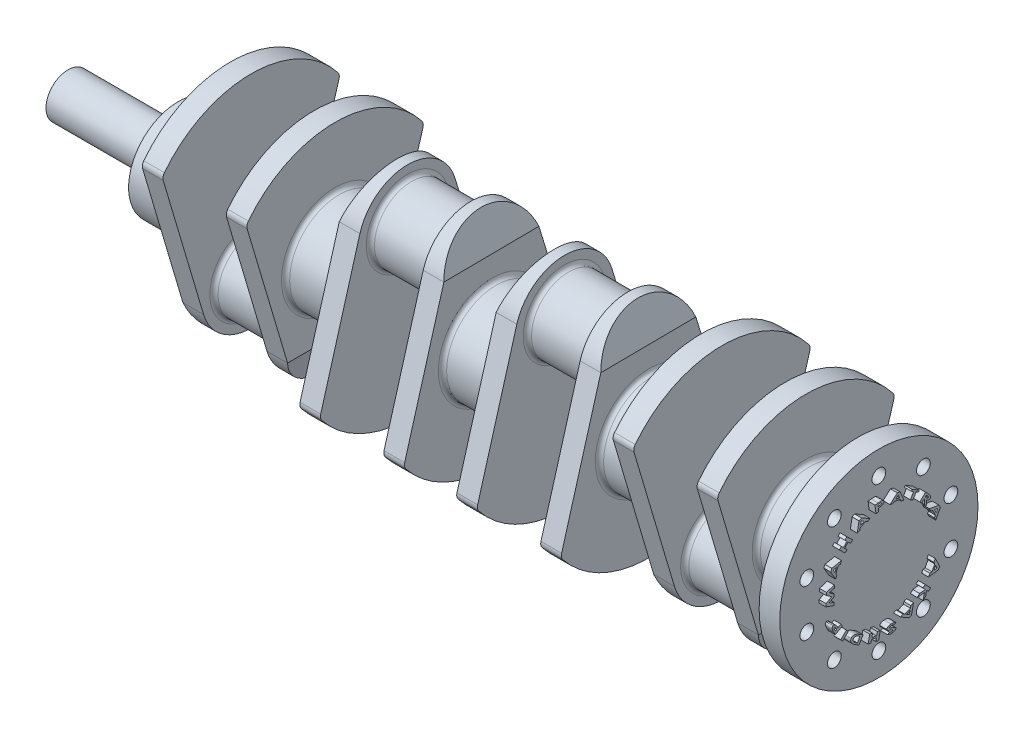
from build123d import *

# Parameters (mm, degrees)
SKETCH1_R               = 36
BOSS_EXTRUDE1_DEPTH     = 38
SKETCH3_R               = 27
BOSS_EXTRUDE2_DEPTH     = 15
SKETCH3_2_R             = 27
BOSS_EXTRUDE3_DEPTH     = 61
CUT_EXTRUDE1_DEPTH      = 143.724458813
CUT_EXTRUDE1_DEPTH_BACK = 143.724458813
BODY_MOVE_COPY1_ANGLE   = 179.5
BOSS_EXTRUDE4_START     = 15
SKETCH5_R               = 72
SKETCH5_R_2             = 5
SKETCH5_R_3             = 36
BOSS_EXTRUDE4_DEPTH     = 15
SKETCH6_R               = 16
BOSS_EXTRUDE5_DEPTH     = 80
FILLET1_R               = 3
FILLET2_R               = 5
WRAP1_DEPTH             = 5


# Read off the part's stored shape, not the designer's step: Wrap1
with BuildPart() as part:
    # Sketch1 → Boss-Extrude1 (new body)
    with BuildSketch(Plane(origin=(0, 0, 0), x_dir=(0, 0, -1), z_dir=(1, 0, 0))):
        Circle(SKETCH1_R)
    extrude(amount=BOSS_EXTRUDE1_DEPTH)

    # Sketch3 → Boss-Extrude2 (add)
    with BuildSketch(Plane(origin=(38, 0, 0), x_dir=(0, 0, -1), z_dir=(1, 0, 0))):
        with BuildLine():
            Line((-34.517510455, -54.224552409), (-64.569893475, 47.23059238))
            ThreePointArc((-64.569893475, 47.23059238), (0, 80), (64.569893475, 47.23059238))
            Line((64.569893475, 47.23059238), (34.517510455, -54.224552409))
            ThreePointArc((34.517510455, -54.224552409), (0, -80), (-34.517510455, -54.224552409))
        make_face()
        with Locations(Location((0, -44, 0), (0, 0, 144.817798311))):
            Circle(SKETCH3_R, mode=Mode.SUBTRACT)
    extrude(amount=BOSS_EXTRUDE2_DEPTH)

    # Sketch3<2> → Boss-Extrude3 (add)
    with BuildSketch(Plane(origin=(38, 0, 0), x_dir=(0, 0, -1), z_dir=(1, 0, 0))):
        with Locations(Location((0, -44, 0), (0, 0, 180))):
            Circle(SKETCH3_2_R)
    extrude(amount=BOSS_EXTRUDE3_DEPTH)

    # Sketch4 → Cut-Extrude1 (cut, two sides: drawn at the far end of the back side and taken through both)
    with BuildSketch(Plane.XY.offset(-CUT_EXTRUDE1_DEPTH_BACK)):
        Polygon((38, -54.224552409), (45.5, -80), (38, -80), align=None)
    extrude(amount=CUT_EXTRUDE1_DEPTH + CUT_EXTRUDE1_DEPTH_BACK, mode=Mode.SUBTRACT)

    # Mirror3: part across plane


with BuildPart() as part_1:
    add(part.part)
    add(part.part.mirror(Plane(origin=(76, 0, 0), x_dir=(0, 0, 1), z_dir=(1, 0, 0))))


with BuildPart() as body_2:
    # Mirror4: mirrored copy
    add(part_1.part.mirror(Plane(origin=(133, 0, 0), x_dir=(0, 0, 1), z_dir=(1, 0, 0))))


with BuildPart() as body_2_1:
    # Body-Move/Copy1: moved
    add(body_2.part.rotate(Axis((0, 0, 0), (-1, 0, 0)), BODY_MOVE_COPY1_ANGLE))


with BuildPart() as part_2:
    add(part_1.part)

    # Combine1: union body 2
    add(body_2_1.part)

    # Mirror5: part across plane


with BuildPart() as part_3:
    add(part_2.part)
    add(part_2.part.mirror(Plane(origin=(247, 0, 0), x_dir=(0, 0, 1), z_dir=(1, 0, 0))))

    # Sketch5 → Boss-Extrude4 (add)
    # profile 1 of 2: a face of its own
    with BuildSketch(Plane(origin=(494, 0, 0), x_dir=(0, 0, -1), z_dir=(1, 0, 0)).offset(BOSS_EXTRUDE4_START)):
        Circle(SKETCH5_R)
        with Locations((-32.328188876, 44.495934691)):
            Circle(SKETCH5_R_2, mode=Mode.SUBTRACT)
        with Locations((-52.308108396, 16.995934691)):
            Circle(SKETCH5_R_2, mode=Mode.SUBTRACT)
        with Locations((-52.308108396, -16.995934691)):
            Circle(SKETCH5_R_2, mode=Mode.SUBTRACT)
        with Locations((-32.328188876, -44.495934691)):
            Circle(SKETCH5_R_2, mode=Mode.SUBTRACT)
        with Locations((0, -55)):
            Circle(SKETCH5_R_2, mode=Mode.SUBTRACT)
        with Locations((32.328188876, -44.495934691)):
            Circle(SKETCH5_R_2, mode=Mode.SUBTRACT)
        with Locations((52.308108396, -16.995934691)):
            Circle(SKETCH5_R_2, mode=Mode.SUBTRACT)
        with Locations((52.308108396, 16.995934691)):
            Circle(SKETCH5_R_2, mode=Mode.SUBTRACT)
        with Locations((32.328188876, 44.495934691)):
            Circle(SKETCH5_R_2, mode=Mode.SUBTRACT)
        with Locations((0, 55)):
            Circle(SKETCH5_R_2, mode=Mode.SUBTRACT)
        Circle(SKETCH5_R_3, mode=Mode.SUBTRACT)
    # profile 2 of 2: a face of its own
    with BuildSketch(Plane(origin=(494, 0, 0), x_dir=(0, 0, -1), z_dir=(1, 0, 0)).offset(BOSS_EXTRUDE4_START)):
        Circle(SKETCH5_R_3)
    extrude(amount=-BOSS_EXTRUDE4_DEPTH)

    # Sketch6 → Boss-Extrude5 (add)
    with BuildSketch(Plane.ZY):
        Circle(SKETCH6_R)
    extrude(amount=BOSS_EXTRUDE5_DEPTH)

    # Fillet1
    fillet1_edges = [part_3.edges().sort_by_distance(p)[0] for p in [
        (53, -44, -27),
        (456, 0, 36),
        (494, 0, 36),
        (441, -44, -27),
        (395, -44, -27),
        (342, 0, 36),
        (380, 0, 36),
        (281, 43.762708156, 27.382939485),
        (327, 43.762708156, 27.382939485),
        (0, 0, -16),
        (99, -44, -27),
        (38, 0, 36),
        (114, 0, 36),
        (152, 0, 36),
        (228, 0.314155278, -35.99862923),
        (266, 0.314155278, -35.99862923),
        (213, 43.762708156, 27.382939485),
        (167, 43.762708156, 27.382939485),
    ]]
    fillet(fillet1_edges, radius=FILLET1_R)

    # Fillet2
    fillet2_edges = [part_3.edges().sort_by_distance(p)[0] for p in [
        (45.5, 47.23059238, 64.569893475),
        (448.5, 47.23059238, -64.569893475),
        (448.5, 47.23059238, 64.569893475),
        (387.5, 47.23059238, -64.569893475),
        (387.5, 47.23059238, 64.569893475),
        (273.5, -47.792265452, 64.155275411),
        (273.5, -46.665322516, -64.979594293),
        (334.5, -47.792265452, 64.155275411),
        (334.5, -46.665322516, -64.979594293),
        (106.5, 47.23059238, -64.569893475),
        (106.5, 47.23059238, 64.569893475),
        (220.5, -47.792265452, 64.155275411),
        (220.5, -46.665322516, -64.979594293),
        (159.5, -47.792265452, 64.155275411),
        (159.5, -46.665322516, -64.979594293),
        (45.5, 47.23059238, -64.569893475),
    ]]
    fillet(fillet2_edges, radius=FILLET2_R)

    # Wrap1 outline → Wrap1 (add)
    # profile 1 of 17: a face of its own
    with BuildSketch(Plane(origin=(509, 0, 0), x_dir=(0, 0, -1), z_dir=(1, 0, 0))):
        with BuildLine():
            add(Edge.make_bspline(
                [(30.429145669, 31.278633196), (30.529714484, 31.175524895), (30.723586774, 30.97675709), (30.998471286, 30.685651702), (31.247338782, 30.41362089), (31.470231429, 30.161696818), (31.665061076, 29.927807723), (31.835209086, 29.715007837), (31.977848594, 29.52002756), (32.09739194, 29.341520557), (32.195364999, 29.171832525), (32.282688438, 29.009274234), (32.355863107, 28.847193799), (32.419966671, 28.687840548), (32.469403122, 28.528430808), (32.510142867, 28.371486623), (32.536172291, 28.215731032), (32.553469658, 28.063541172), (32.55684607, 27.91529612), (32.548408891, 27.773035329), (32.524589617, 27.637930635), (32.488880662, 27.509728828), (32.438023848, 27.389132553), (32.37520509, 27.275109299), (32.297221124, 27.16917764), (32.236800833, 27.105186363), (32.206178923, 27.072754623)],
                knots=[0, 0, 0, 0, 0.086183646, 0.166141174, 0.239561119, 0.306794224, 0.367392138, 0.421693658, 0.469793409, 0.511914684, 0.5501677, 0.58699646, 0.622277761, 0.656525956, 0.689699113, 0.722076818, 0.753468047, 0.784108508, 0.813653429, 0.842088185, 0.869235459, 0.895591144, 0.921549795, 0.947369509, 0.973326077, 1, 1, 1, 1], degree=3))
            Line((30.429145669, 31.278633196), (28.898145235, 32.836452373))
            Line((28.898145235, 32.836452373), (24.770390828, 28.78099197))
            Line((24.770390828, 28.78099197), (26.213938839, 27.311791248))
            Line((26.213938839, 27.311791248), (27.961821284, 29.029356853))
            Line((27.961821284, 29.029356853), (28.095915, 28.892931072))
            Line((28.095915, 28.892931072), (28.055103869, 25.439143345))
            Line((28.055103869, 25.439143345), (29.632745596, 23.833516843))
            Line((29.632745596, 23.833516843), (29.673556727, 27.46337545))
            add(Edge.make_bspline(
                [(32.206178923, 27.072754623), (32.171961657, 27.041121702), (32.104221329, 26.97849763), (31.990451903, 26.901801135), (31.869962485, 26.840696535), (31.743165908, 26.79307029), (31.608554693, 26.763003301), (31.466866723, 26.749837996), (31.318767717, 26.749263935), (31.163509451, 26.766904468), (31.001494792, 26.798121919), (30.832517724, 26.847024585), (30.656742721, 26.911613183), (30.473476864, 26.991243783), (30.283170427, 27.086515942), (30.08501184, 27.195703857), (29.880398297, 27.322481134), (29.743945745, 27.415428548), (29.673556727, 27.46337545)],
                knots=[0, 0, 0, 0, 0.050124638, 0.099232343, 0.14715377, 0.195359514, 0.244709218, 0.295187372, 0.348344958, 0.403905245, 0.463173033, 0.525841674, 0.593106823, 0.664720363, 0.740905851, 0.822215008, 0.908289653, 1, 1, 1, 1], degree=3))
        make_face()
        with BuildLine():
            add(Edge.make_bspline(
                [(29.182657121, 29.319698901), (29.238412559, 29.263513059), (29.345092754, 29.156009347), (29.501859082, 29.004855542), (29.648088289, 28.870671225), (29.785249965, 28.754042322), (29.910196652, 28.651940565), (30.026020716, 28.567823102), (30.130415707, 28.499153161), (30.226555787, 28.447933205), (30.315355525, 28.410286306), (30.399698109, 28.387035496), (30.479615524, 28.374216182), (30.555620577, 28.3756137), (30.628043002, 28.388044977), (30.696050095, 28.414438721), (30.760670545, 28.451843357), (30.797433269, 28.485984366), (30.816268399, 28.503476278)],
                knots=[0, 0, 0, 0, 0.11871841, 0.227150992, 0.326598645, 0.416323744, 0.497170778, 0.568533097, 0.630950928, 0.684412112, 0.731721949, 0.775284498, 0.8153523, 0.852666451, 0.888800719, 0.924963191, 0.961555406, 1, 1, 1, 1], degree=3))
            Line((29.182657121, 29.319698901), (28.727904517, 29.781447699))
            Line((28.727904517, 29.781447699), (29.572111915, 30.611662709))
            Line((29.572111915, 30.611662709), (29.968562904, 30.208215527))
            add(Edge.make_bspline(
                [(30.816268399, 28.503476278), (30.836700296, 28.526640455), (30.877740004, 28.573168249), (30.914707454, 28.661305922), (30.931124018, 28.760164094), (30.924532334, 28.868789509), (30.901054465, 28.985355536), (30.857967242, 29.10678091), (30.797799835, 29.232625813), (30.731975951, 29.339354876), (30.6684681, 29.433178212), (30.604002347, 29.512772859), (30.530345492, 29.60522887), (30.442411303, 29.706354153), (30.341799628, 29.817241255), (30.228557933, 29.938032555), (30.103829801, 30.070585617), (30.014996402, 30.16097087), (29.968562904, 30.208215527)],
                knots=[0, 0, 0, 0, 0.044650945, 0.089686329, 0.136688453, 0.189283969, 0.246905011, 0.30908811, 0.376061549, 0.449318408, 0.491164293, 0.540670563, 0.598116814, 0.663018007, 0.735422287, 0.815776509, 0.9037058, 1, 1, 1, 1], degree=3))
        make_face(mode=Mode.SUBTRACT)
    # profile 2 of 17: a face of its own
    with BuildSketch(Plane(origin=(509, 0, 0), x_dir=(0, 0, -1), z_dir=(1, 0, 0))):
        with BuildLine():
            add(Edge.make_bspline(
                [(-5.622220222, 43.296977633), (-5.480400337, 43.312592244), (-5.206677104, 43.342729638), (-4.810936692, 43.378860622), (-4.445112894, 43.405660973), (-4.109669055, 43.425115991), (-3.8040552, 43.434317908), (-3.528746531, 43.436338864), (-3.283637265, 43.42882642), (-3.065315646, 43.411467215), (-2.86672486, 43.384619422), (-2.680272938, 43.353393101), (-2.503944058, 43.310402051), (-2.336845204, 43.262493672), (-2.180042362, 43.204261582), (-2.031355707, 43.141492745), (-1.893810958, 43.066987109), (-1.765300678, 42.987381996), (-1.648744829, 42.899865775), (-1.543982804, 42.806742157), (-1.453404254, 42.705962781), (-1.377516566, 42.597896413), (-1.31382102, 42.484484312), (-1.264464273, 42.364337649), (-1.229021656, 42.237438112), (-1.216374339, 42.149788123), (-1.209953929, 42.105292603)],
                knots=[0, 0, 0, 0, 0.085263731, 0.164565526, 0.237464279, 0.304463238, 0.3653482, 0.420166087, 0.468971369, 0.511852137, 0.550977558, 0.588706681, 0.624763539, 0.659382178, 0.692523, 0.724669681, 0.755740161, 0.785901322, 0.814935959, 0.842732648, 0.869545314, 0.895710275, 0.921497217, 0.947119392, 0.973155158, 1, 1, 1, 1], degree=3))
            Line((-5.622220222, 43.296977633), (-7.798036528, 43.053276878))
            Line((-7.798036528, 43.053276878), (-7.15555272, 37.317563904))
            Line((-7.15555272, 37.317563904), (-5.104501872, 37.547272271))
            Line((-5.104501872, 37.547272271), (-5.377353435, 39.97611759))
            add(Edge.make_bspline(
                [(-3.226023807, 40.308436801), (-3.279558015, 40.294771483), (-3.396547762, 40.264908294), (-3.589083268, 40.226859362), (-3.812043643, 40.185482526), (-4.066113743, 40.145593177), (-4.350636096, 40.103624517), (-4.665426864, 40.060431791), (-5.010985976, 40.017293707), (-5.251779336, 39.99023089), (-5.377353435, 39.97611759)],
                knots=[0, 0, 0, 0, 0.076079011, 0.166257513, 0.270200311, 0.388387942, 0.52041265, 0.666291712, 0.825970627, 1, 1, 1, 1], degree=3))
            add(Edge.make_bspline(
                [(-1.209953929, 42.105292603), (-1.206300346, 42.055950966), (-1.199100534, 41.958717503), (-1.211319953, 41.813395423), (-1.243098574, 41.672682688), (-1.293800521, 41.536279302), (-1.363582145, 41.404227975), (-1.453054451, 41.277102347), (-1.561157055, 41.153776013), (-1.689059968, 41.037062105), (-1.831919809, 40.924172382), (-1.990114637, 40.818613509), (-2.161106307, 40.717592016), (-2.346791019, 40.62369052), (-2.546479501, 40.535068163), (-2.760248551, 40.452649595), (-2.987566383, 40.375079451), (-3.145333203, 40.330987727), (-3.226023807, 40.308436801)],
                knots=[0, 0, 0, 0, 0.050511539, 0.099538891, 0.148405011, 0.197554546, 0.247846877, 0.300638037, 0.356100292, 0.415136975, 0.477370203, 0.542050923, 0.609369429, 0.680262357, 0.754605722, 0.832589137, 0.914376903, 1, 1, 1, 1], degree=3))
        make_face()
        with BuildLine():
            add(Edge.make_bspline(
                [(-4.844476665, 41.114165133), (-4.783069442, 41.12157563), (-4.66489817, 41.135836297), (-4.494823779, 41.15594357), (-4.339818351, 41.178434731), (-4.199463228, 41.200445255), (-4.073900252, 41.222559957), (-3.962813041, 41.243927313), (-3.86745717, 41.267786799), (-3.761296366, 41.295986876), (-3.64692827, 41.338154972), (-3.524266088, 41.394408491), (-3.419145516, 41.460199428), (-3.331369841, 41.532975402), (-3.261755654, 41.612447999), (-3.214928194, 41.698737246), (-3.191178295, 41.790778376), (-3.193412214, 41.852540334), (-3.194540935, 41.883746463)],
                knots=[0, 0, 0, 0, 0.093628204, 0.180176914, 0.259221216, 0.330702091, 0.395219142, 0.452218799, 0.501877336, 0.543984089, 0.618427735, 0.686066927, 0.747932726, 0.805560497, 0.858144179, 0.906838381, 0.952928734, 1, 1, 1, 1], degree=3))
            Line((-4.844476665, 41.114165133), (-5.496288731, 41.040705097))
            Line((-5.496288731, 41.040705097), (-5.628050383, 42.213733609))
            Line((-5.628050383, 42.213733609), (-5.049698353, 42.279031419))
            add(Edge.make_bspline(
                [(-3.733247866, 42.312846356), (-3.766610864, 42.318419365), (-3.839219596, 42.330548046), (-3.958188721, 42.338214739), (-4.09505456, 42.343248753), (-4.250263839, 42.341493053), (-4.424056137, 42.334295124), (-4.616496058, 42.321250782), (-4.827133079, 42.302308516), (-4.973536872, 42.286996804), (-5.049698353, 42.279031419)],
                knots=[0, 0, 0, 0, 0.076795943, 0.167132944, 0.270497902, 0.38793295, 0.519598425, 0.665607792, 0.826044084, 1, 1, 1, 1], degree=3))
            add(Edge.make_bspline(
                [(-3.194540935, 41.883746463), (-3.198826595, 41.910485214), (-3.207286662, 41.963268594), (-3.240068496, 42.036635573), (-3.286717412, 42.102102904), (-3.347645678, 42.160183568), (-3.423673513, 42.210270246), (-3.513971504, 42.253100692), (-3.618685583, 42.287853279), (-3.693807703, 42.304242032), (-3.733247866, 42.312846356)],
                knots=[0, 0, 0, 0, 0.10925285, 0.215669566, 0.321771664, 0.433068059, 0.554402804, 0.688837443, 0.836635309, 1, 1, 1, 1], degree=3))
        make_face(mode=Mode.SUBTRACT)
    # profile 3 of 17: a face of its own
    with BuildSketch(Plane(origin=(509, 0, 0), x_dir=(0, 0, -1), z_dir=(1, 0, 0))):
        with BuildLine():
            add(Edge.make_bspline(
                [(-37.6596163, -22.112060764), (-37.729142009, -21.987483758), (-37.863159205, -21.747350127), (-38.051321694, -21.3973175), (-38.218808858, -21.071333799), (-38.367938928, -20.770146189), (-38.49606757, -20.492854973), (-38.605553252, -20.240256195), (-38.692923128, -20.011193031), (-38.764028601, -19.804272258), (-38.817000007, -19.611197005), (-38.85944948, -19.427704374), (-38.889915143, -19.249354534), (-38.909793846, -19.0769213), (-38.919815247, -18.90987164), (-38.917129491, -18.748592087), (-38.90500097, -18.592985072), (-38.880141999, -18.443764972), (-38.846122014, -18.301789681), (-38.799589048, -18.169117543), (-38.740258062, -18.046988849), (-38.672351789, -17.933622358), (-38.59176824, -17.830938675), (-38.500522371, -17.738295281), (-38.397231175, -17.656099002), (-38.321668982, -17.61000657), (-38.28344359, -17.586689336)],
                knots=[0, 0, 0, 0, 0.085281514, 0.164387959, 0.237543378, 0.304357025, 0.365275386, 0.420129158, 0.468888674, 0.511797458, 0.550862296, 0.588513439, 0.624342608, 0.658955573, 0.692232668, 0.724299458, 0.755306674, 0.785444252, 0.814634604, 0.842485815, 0.869297104, 0.89567604, 0.921331871, 0.947126202, 0.97325221, 1, 1, 1, 1], degree=3))
            Line((-37.6596163, -22.112060764), (-36.586866567, -24.01619154))
            Line((-36.586866567, -24.01619154), (-31.548440919, -21.176902844))
            Line((-31.548440919, -21.176902844), (-32.560556971, -19.381213074))
            Line((-32.560556971, -19.381213074), (-34.694396114, -20.583392394))
            add(Edge.make_bspline(
                [(-35.839439851, -18.736397202), (-35.806096198, -18.780483845), (-35.733334243, -18.876688975), (-35.622156202, -19.038254999), (-35.497747142, -19.226785002), (-35.360672871, -19.44356896), (-35.212614477, -19.689192572), (-35.050245972, -19.96227076), (-34.875271666, -20.262866532), (-34.756330253, -20.473640174), (-34.694396114, -20.583392394)],
                knots=[0, 0, 0, 0, 0.076248107, 0.166387334, 0.270489101, 0.387859604, 0.520188358, 0.666126712, 0.826148401, 1, 1, 1, 1], degree=3))
            add(Edge.make_bspline(
                [(-38.28344359, -17.586689336), (-38.239279681, -17.564079795), (-38.152059664, -17.519427848), (-38.013228165, -17.47452152), (-37.871535937, -17.446646318), (-37.725836973, -17.439931377), (-37.576707549, -17.453586496), (-37.424298836, -17.485015423), (-37.269310157, -17.537973935), (-37.111275988, -17.607774369), (-36.952034961, -17.695846275), (-36.792081689, -17.798860909), (-36.631737008, -17.916938784), (-36.472852017, -18.051757577), (-36.312041614, -18.19952693), (-36.154620686, -18.365371791), (-35.993489804, -18.54292301), (-35.891596991, -18.670892082), (-35.839439851, -18.736397202)],
                knots=[0, 0, 0, 0, 0.050632458, 0.09999486, 0.148525686, 0.197835325, 0.248467783, 0.301204873, 0.356470488, 0.415512229, 0.477548236, 0.54222254, 0.60982719, 0.680872694, 0.75507247, 0.832882904, 0.914455694, 1, 1, 1, 1], degree=3))
        make_face()
        with BuildLine():
            add(Edge.make_bspline(
                [(-35.950212921, -20.540249199), (-35.980772721, -20.4861404), (-36.039262614, -20.38257893), (-36.125791522, -20.234762413), (-36.207908649, -20.101437836), (-36.281312061, -19.979676571), (-36.351683206, -19.873626931), (-36.415971942, -19.781197832), (-36.47375888, -19.701854257), (-36.542207768, -19.616078555), (-36.625930831, -19.527514708), (-36.725416408, -19.436015575), (-36.82773037, -19.365612006), (-36.928814375, -19.313041247), (-37.02876529, -19.281944383), (-37.125695483, -19.271040862), (-37.219728843, -19.284797691), (-37.275739848, -19.311687617), (-37.303976443, -19.325243523)],
                knots=[0, 0, 0, 0, 0.094145789, 0.18019022, 0.25946636, 0.331373404, 0.395557877, 0.45224046, 0.501941496, 0.544244423, 0.618401923, 0.686375025, 0.748606577, 0.80601552, 0.858356821, 0.906285607, 0.952756154, 1, 1, 1, 1], degree=3))
            Line((-35.950212921, -20.540249199), (-35.629554033, -21.110439002))
            Line((-35.629554033, -21.110439002), (-36.660326603, -21.691123097))
            Line((-36.660326603, -21.691123097), (-36.944838489, -21.185065071))
            add(Edge.make_bspline(
                [(-37.489375581, -19.98754988), (-37.481709477, -20.020336808), (-37.464999894, -20.091801521), (-37.426337088, -20.204790645), (-37.376060916, -20.332562743), (-37.313884848, -20.474755365), (-37.240049736, -20.632052951), (-37.152437079, -20.803441095), (-37.053430089, -20.990097393), (-36.982001205, -21.118342337), (-36.944838489, -21.185065071)],
                knots=[0, 0, 0, 0, 0.076522088, 0.166792964, 0.271172315, 0.388728042, 0.519589831, 0.666225044, 0.826344985, 1, 1, 1, 1], degree=3))
            add(Edge.make_bspline(
                [(-37.303976443, -19.325243523), (-37.326941597, -19.339390127), (-37.372254576, -19.367303058), (-37.425834394, -19.426688848), (-37.46960177, -19.494321271), (-37.497710037, -19.573825258), (-37.515609257, -19.662906253), (-37.519327544, -19.76226064), (-37.510582485, -19.872019951), (-37.496705038, -19.947620827), (-37.489375581, -19.98754988)],
                knots=[0, 0, 0, 0, 0.108860319, 0.214794341, 0.321056187, 0.433773539, 0.554329405, 0.68845439, 0.835455331, 1, 1, 1, 1], degree=3))
        make_face(mode=Mode.SUBTRACT)
    # profile 4 of 17: a face of its own
    with BuildSketch(Plane(origin=(509, 0, 0), x_dir=(0, 0, -1), z_dir=(1, 0, 0))):
        with BuildLine():
            add(Edge.make_bspline(
                [(-21.561806926, -37.865119371), (-21.64431798, -37.813990965), (-21.806295318, -37.713620861), (-22.043533488, -37.562414882), (-22.272021808, -37.415396561), (-22.489458779, -37.268323213), (-22.700398417, -37.128735099), (-22.899184734, -36.987554836), (-23.090400895, -36.852181365), (-23.271615083, -36.718420197), (-23.444120558, -36.588705679), (-23.6060531, -36.460082544), (-23.758906928, -36.334950424), (-23.903782283, -36.214499387), (-24.038101314, -36.095259351), (-24.162594345, -35.978288561), (-24.279353505, -35.866067769), (-24.420191376, -35.720185143), (-24.582286171, -35.537945469), (-24.759729084, -35.31401759), (-24.919760636, -35.086033128), (-25.063789909, -34.855205853), (-25.189978882, -34.620355409), (-25.299242743, -34.381797211), (-25.389692476, -34.138722046), (-25.464985574, -33.894253275), (-25.5187656, -33.650242248), (-25.550182599, -33.410253443), (-25.555508477, -33.176246405), (-25.539924592, -32.947984148), (-25.499313491, -32.725605378), (-25.432169603, -32.509876706), (-25.346333131, -32.298212847), (-25.26911768, -32.165881417), (-25.230144599, -32.099089557)],
                knots=[0, 0, 0, 0, 0.038475521, 0.075531242, 0.111512892, 0.146166871, 0.179581902, 0.211766711, 0.242804186, 0.272447562, 0.301042266, 0.328351756, 0.354411043, 0.379344812, 0.403027242, 0.425590776, 0.447054505, 0.467211112, 0.505952528, 0.543680493, 0.580396447, 0.616308104, 0.651462248, 0.68600337, 0.72022797, 0.754198136, 0.787318856, 0.819155159, 0.849977758, 0.879944067, 0.909708904, 0.939340667, 0.969383315, 1, 1, 1, 1], degree=3))
            Line((-21.561806926, -37.865119371), (-19.480439237, -39.150086986))
            Line((-19.480439237, -39.150086986), (-16.434762822, -34.218936311))
            Line((-16.434762822, -34.218936311), (-18.547613383, -32.914146147))
            add(Edge.make_bspline(
                [(-25.230144599, -32.099089557), (-25.200265984, -32.052638175), (-25.140747522, -31.960106616), (-25.03738554, -31.83263907), (-24.926214697, -31.71338254), (-24.804448831, -31.605542959), (-24.674963684, -31.505533309), (-24.535249952, -31.416952355), (-24.386730603, -31.337525572), (-24.229366072, -31.267544837), (-24.064298474, -31.208638117), (-23.893560476, -31.159862314), (-23.71812174, -31.119847388), (-23.537076947, -31.090413281), (-23.350412596, -31.073744945), (-23.158592321, -31.065662745), (-22.961607007, -31.066195976), (-22.691940259, -31.08463763), (-22.351802784, -31.127543172), (-21.944108552, -31.210140549), (-21.539614433, -31.327984495), (-21.238324824, -31.43824664), (-21.035124176, -31.525235816), (-20.923210632, -31.575470138), (-20.803400813, -31.631267946), (-20.675801002, -31.693273275), (-20.541055815, -31.761973426), (-20.398394137, -31.837315425), (-20.247397264, -31.916706305), (-20.08948154, -32.004225785), (-19.922774664, -32.095405496), (-19.749401393, -32.19480815), (-19.568327207, -32.300500272), (-19.378372359, -32.409880353), (-19.182786404, -32.529352425), (-18.977071115, -32.650446971), (-18.765163523, -32.780654344), (-18.621077617, -32.869067467), (-18.547613383, -32.914146147)],
                knots=[0, 0, 0, 0, 0.022205579, 0.044233707, 0.065916113, 0.087732869, 0.109594972, 0.131674658, 0.154201662, 0.177303159, 0.2008969, 0.224653314, 0.248704342, 0.27325547, 0.29838493, 0.324053524, 0.350481098, 0.377588334, 0.432749826, 0.48828882, 0.544758688, 0.602099999, 0.617232715, 0.633681684, 0.65145124, 0.670404062, 0.69075485, 0.712298093, 0.73531263, 0.759386523, 0.784933368, 0.811757681, 0.839785194, 0.869287189, 0.899939973, 0.931987373, 0.965322802, 1, 1, 1, 1], degree=3))
        make_face()
        with BuildLine():
            add(Edge.make_bspline(
                [(-19.566725629, -33.55429789), (-19.663666815, -33.494839391), (-19.850735964, -33.380101256), (-20.124840393, -33.220369408), (-20.381235172, -33.077707743), (-20.620024435, -32.953026662), (-20.840512999, -32.844859384), (-21.043751509, -32.755138956), (-21.228258607, -32.6804912), (-21.39877483, -32.624739975), (-21.558726467, -32.581640551), (-21.713846076, -32.55056676), (-21.866322405, -32.527608397), (-22.016727189, -32.51606557), (-22.165188948, -32.514644613), (-22.311231836, -32.524372156), (-22.455110518, -32.542622892), (-22.59583814, -32.571809175), (-22.732024854, -32.610616385), (-22.860983647, -32.662125604), (-22.982013755, -32.725591781), (-23.095569114, -32.800712219), (-23.202564215, -32.887059334), (-23.299995809, -32.986885859), (-23.390977417, -33.097043484), (-23.443746629, -33.177523072), (-23.470601831, -33.218480582)],
                knots=[0, 0, 0, 0, 0.077761743, 0.150058232, 0.216918162, 0.278377842, 0.334244975, 0.384816171, 0.430271195, 0.47027762, 0.507411471, 0.543480977, 0.578399183, 0.6127874, 0.646542247, 0.679832461, 0.712798571, 0.74563694, 0.778019342, 0.80950702, 0.840416208, 0.871302534, 0.902475694, 0.934236993, 0.966532022, 1, 1, 1, 1], degree=3))
            Line((-19.566725629, -33.55429789), (-18.751669038, -34.058023851))
            Line((-18.751669038, -34.058023851), (-20.670958234, -37.16549998))
            Line((-20.670958234, -37.16549998), (-21.266800749, -36.797033767))
            add(Edge.make_bspline(
                [(-23.401805924, -34.940710316), (-23.379995137, -34.976299223), (-23.3351374, -35.049494094), (-23.259565979, -35.157602317), (-23.173341333, -35.265803212), (-23.080924418, -35.377025333), (-22.977142002, -35.487301473), (-22.866775413, -35.600882967), (-22.746397532, -35.7150276), (-22.616921744, -35.830070987), (-22.479186323, -35.94706112), (-22.33225611, -36.064433003), (-22.176567435, -36.18351938), (-22.012879082, -36.305096287), (-21.838324563, -36.425491593), (-21.657071615, -36.549900979), (-21.465029177, -36.673116681), (-21.33373619, -36.755190905), (-21.266800749, -36.797033767)],
                knots=[0, 0, 0, 0, 0.043879701, 0.090246356, 0.138560192, 0.189313178, 0.242231077, 0.297713932, 0.355812362, 0.416592433, 0.479799539, 0.545789492, 0.614282789, 0.685880143, 0.760133794, 0.837206952, 0.917005281, 1, 1, 1, 1], degree=3))
            add(Edge.make_bspline(
                [(-23.470601831, -33.218480582), (-23.507724623, -33.283543299), (-23.580678018, -33.411403994), (-23.651918055, -33.617984632), (-23.694908694, -33.828223173), (-23.700580096, -34.043554162), (-23.675752306, -34.263407437), (-23.616980523, -34.487355209), (-23.526764761, -34.716560021), (-23.444428129, -34.864254901), (-23.401805924, -34.940710316)],
                knots=[0, 0, 0, 0, 0.123182135, 0.242076482, 0.358249215, 0.475504185, 0.595374134, 0.721650234, 0.855910056, 1, 1, 1, 1], degree=3))
        make_face(mode=Mode.SUBTRACT)
    # profile 5 of 17: a face of its own
    with BuildSketch(Plane(origin=(509, 0, 0), x_dir=(0, 0, -1), z_dir=(1, 0, 0))):
        with BuildLine():
            add(Edge.make_bspline(
                [(2.750963939, -42.105921218), (2.821962944, -42.146535427), (2.960895025, -42.226010014), (3.174397596, -42.326723387), (3.387078997, -42.40892957), (3.599229571, -42.472038905), (3.810256128, -42.516476894), (4.019922398, -42.544106609), (4.229306192, -42.551703598), (4.36790583, -42.541351379), (4.437046671, -42.536187143)],
                knots=[0, 0, 0, 0, 0.138559973, 0.271136551, 0.399564926, 0.524597876, 0.645761688, 0.764623122, 0.882581545, 1, 1, 1, 1], degree=3))
            Line((2.750963939, -42.105921218), (1.306249896, -42.971117198))
            add(Edge.make_bspline(
                [(4.510506707, -43.583284165), (4.377667769, -43.593888053), (4.114224691, -43.614917435), (3.721077408, -43.616986973), (3.335061527, -43.592334463), (3.017829671, -43.550723728), (2.764361224, -43.502726234), (2.570400386, -43.45571538), (2.3711083, -43.399748659), (2.167844377, -43.33245497), (1.958207035, -43.258796093), (1.745142695, -43.171141303), (1.526170216, -43.076526773), (1.380262091, -43.006591837), (1.306249896, -42.971117198)],
                knots=[0, 0, 0, 0, 0.120763213, 0.239494784, 0.355993244, 0.471143555, 0.529253843, 0.589754305, 0.651989177, 0.716831998, 0.783805763, 0.853350778, 0.925611883, 1, 1, 1, 1], degree=3))
            add(Edge.make_bspline(
                [(7.325308724, -41.838899817), (7.327599398, -41.8883383), (7.332161495, -41.986799746), (7.304776221, -42.134636832), (7.249391529, -42.278100367), (7.169012227, -42.420331399), (7.058655511, -42.557183184), (6.92296498, -42.692387783), (6.759555545, -42.823486442), (6.571934532, -42.951484482), (6.36433964, -43.072475165), (6.14018527, -43.18245067), (5.90254799, -43.280120431), (5.650781552, -43.365116322), (5.385629447, -43.438406948), (5.106643258, -43.50020785), (4.813504524, -43.549224103), (4.612851565, -43.571779554), (4.510506707, -43.583284165)],
                knots=[0, 0, 0, 0, 0.041256494, 0.082166235, 0.124520739, 0.169325696, 0.218131309, 0.270962205, 0.329153765, 0.392946586, 0.460639787, 0.529791942, 0.601458201, 0.675215723, 0.751742568, 0.831266396, 0.913935898, 1, 1, 1, 1], degree=3))
            add(Edge.make_bspline(
                [(4.341432021, -40.107341824), (4.416097745, -40.131317893), (4.562500345, -40.17832954), (4.777043297, -40.249505175), (4.981472426, -40.319145672), (5.175654415, -40.38723692), (5.360107405, -40.452311552), (5.534815757, -40.51598269), (5.6986598, -40.579668581), (5.853737784, -40.638357207), (5.997542902, -40.698096358), (6.131936192, -40.755442903), (6.256801068, -40.809597787), (6.370803924, -40.863496404), (6.475264732, -40.914672035), (6.569232708, -40.964689773), (6.653899101, -41.01244102), (6.751244644, -41.073376158), (6.858974473, -41.14944903), (6.973936688, -41.242540301), (7.072959482, -41.337452005), (7.156203399, -41.434003708), (7.223567083, -41.532381701), (7.274699896, -41.632499913), (7.309500045, -41.734760025), (7.320083241, -41.804476908), (7.325308724, -41.838899817)],
                knots=[0, 0, 0, 0, 0.065545193, 0.1285193, 0.188926449, 0.246050725, 0.300507776, 0.352409746, 0.401459837, 0.447431183, 0.490988345, 0.531597586, 0.569563558, 0.604732943, 0.636986182, 0.666778134, 0.693694798, 0.71821285, 0.76273812, 0.803835604, 0.841744548, 0.877227618, 0.910205667, 0.94115137, 0.970943322, 1, 1, 1, 1], degree=3))
            add(Edge.make_bspline(
                [(2.778948714, -39.268964587), (2.785926043, -39.301615002), (2.800607182, -39.370315405), (2.86676135, -39.465065298), (2.963257958, -39.554656955), (3.069906535, -39.622922855), (3.176536077, -39.68027547), (3.281702667, -39.726656223), (3.407011537, -39.779747981), (3.553557254, -39.835988897), (3.720613554, -39.898023926), (3.908772871, -39.96444384), (4.117836794, -40.035376338), (4.264793799, -40.082675345), (4.341432021, -40.107341824)],
                knots=[0, 0, 0, 0, 0.054101548, 0.113836168, 0.184831872, 0.268698095, 0.319855187, 0.382681631, 0.45642095, 0.542303179, 0.639183827, 0.747681161, 0.868415479, 1, 1, 1, 1], degree=3))
            add(Edge.make_bspline(
                [(3.969467711, -38.601994101), (3.88482216, -38.611850869), (3.722295886, -38.630776656), (3.492141195, -38.686982704), (3.284263754, -38.758070371), (3.128999973, -38.834306804), (3.021137803, -38.902896166), (2.951561405, -38.952355737), (2.894328145, -39.003797984), (2.847526133, -39.055150554), (2.813489619, -39.108257138), (2.789303282, -39.161016805), (2.776437899, -39.215128076), (2.778112368, -39.251031782), (2.778948714, -39.268964587)],
                knots=[0, 0, 0, 0, 0.174349491, 0.334765062, 0.484028878, 0.623553968, 0.687586789, 0.74569178, 0.798105447, 0.844900455, 0.887508139, 0.926700886, 0.963389331, 1, 1, 1, 1], degree=3))
            add(Edge.make_bspline(
                [(5.831621324, -39.183844228), (5.760643644, -39.129668189), (5.621276598, -39.023291726), (5.399855727, -38.888819115), (5.1734445, -38.779924745), (4.942641863, -38.693667521), (4.706143981, -38.632876841), (4.464726108, -38.596855104), (4.218082643, -38.58406298), (4.052991575, -38.59597002), (3.969467711, -38.601994101)],
                knots=[0, 0, 0, 0, 0.133680957, 0.262487026, 0.387218084, 0.509534304, 0.630974451, 0.752259587, 0.874661684, 1, 1, 1, 1], degree=3))
            Line((5.831621324, -39.183844228), (7.497881507, -38.458572126))
            add(Edge.make_bspline(
                [(3.910000063, -37.559561209), (4.004396925, -37.55103752), (4.190261648, -37.534254621), (4.465681666, -37.522352037), (4.732881544, -37.51759599), (4.99154033, -37.526547609), (5.241738118, -37.543378254), (5.483384501, -37.571375532), (5.716907968, -37.609695461), (5.94226859, -37.658653109), (6.160415, -37.718099195), (6.371204846, -37.789521379), (6.576541406, -37.870802944), (6.774159703, -37.965855109), (6.966565706, -38.07033119), (7.150272146, -38.188930868), (7.328828305, -38.316991453), (7.441318499, -38.41120107), (7.497881507, -38.458572126)],
                knots=[0, 0, 0, 0, 0.074632042, 0.146948358, 0.217049613, 0.285035976, 0.350700541, 0.414486187, 0.476532479, 0.536991028, 0.59602568, 0.654490197, 0.712182794, 0.7698234, 0.827084838, 0.884484371, 0.941915724, 1, 1, 1, 1], degree=3))
            add(Edge.make_bspline(
                [(0.76987503, -39.516163439), (0.766532616, -39.458183106), (0.759875368, -39.34270084), (0.788776208, -39.170475426), (0.845670139, -39.003624561), (0.932195217, -38.842384502), (1.049112304, -38.68749556), (1.193422031, -38.536303047), (1.369188488, -38.392315556), (1.571439588, -38.253461619), (1.797275036, -38.123144987), (2.043401105, -38.003540914), (2.308877585, -37.898377976), (2.592330314, -37.803305802), (2.895356028, -37.723964603), (3.216623039, -37.654939081), (3.556755909, -37.598961222), (3.790538941, -37.572885618), (3.910000063, -37.559561209)],
                knots=[0, 0, 0, 0, 0.043036937, 0.085718773, 0.128731481, 0.173560328, 0.221036318, 0.272508867, 0.328488252, 0.389526802, 0.454610659, 0.522029496, 0.592653766, 0.666623165, 0.744025895, 0.82524754, 0.910702994, 1, 1, 1, 1], degree=3))
            add(Edge.make_bspline(
                [(2.042016289, -40.712512598), (1.989043348, -40.689838241), (1.88683008, -40.646087224), (1.739946312, -40.578244421), (1.604503759, -40.509558687), (1.480541342, -40.440081717), (1.367753099, -40.370818751), (1.265805885, -40.302609754), (1.17599758, -40.232605495), (1.073059438, -40.140820201), (0.964476255, -40.020449739), (0.866911527, -39.861673542), (0.796376497, -39.693820749), (0.778723171, -39.575478531), (0.76987503, -39.516163439)],
                knots=[0, 0, 0, 0, 0.094077809, 0.181526647, 0.264115462, 0.341965138, 0.413472961, 0.480181915, 0.542129824, 0.599205414, 0.705292573, 0.805320782, 0.902423531, 1, 1, 1, 1], degree=3))
            add(Edge.make_bspline(
                [(3.528707495, -41.229064915), (3.431501058, -41.196915196), (3.247473735, -41.136050641), (2.98687643, -41.047988222), (2.755658773, -40.970469387), (2.555100048, -40.900167062), (2.383584101, -40.841302685), (2.24341364, -40.789319647), (2.131859389, -40.749739579), (2.06875849, -40.723593375), (2.042016289, -40.712512598)],
                knots=[0, 0, 0, 0, 0.195133035, 0.369418027, 0.52426097, 0.659903471, 0.774465009, 0.869840866, 0.944838475, 1, 1, 1, 1], degree=3))
            add(Edge.make_bspline(
                [(5.104017157, -41.815579171), (5.076547186, -41.801706558), (5.011620821, -41.768918089), (4.895541238, -41.719948059), (4.747421336, -41.660535519), (4.566547599, -41.592008896), (4.353372337, -41.514362455), (4.108103655, -41.42619243), (3.829186723, -41.331578355), (3.632472948, -41.264466209), (3.528707495, -41.229064915)],
                knots=[0, 0, 0, 0, 0.054878356, 0.129707169, 0.224587193, 0.339566481, 0.474671643, 0.629265877, 0.804439754, 1, 1, 1, 1], degree=3))
            add(Edge.make_bspline(
                [(5.315069007, -42.069774216), (5.310375665, -42.045852116), (5.300650637, -41.996283366), (5.253839008, -41.929635729), (5.188665544, -41.866962526), (5.133608258, -41.833541593), (5.104017157, -41.815579171)],
                knots=[0, 0, 0, 0, 0.211354842, 0.437946316, 0.697918512, 1, 1, 1, 1], degree=3))
            add(Edge.make_bspline(
                [(4.437046671, -42.536187143), (4.500962761, -42.528324716), (4.623026302, -42.513309471), (4.795705927, -42.474798002), (4.949203035, -42.424624434), (5.080228104, -42.361236553), (5.185641742, -42.291606842), (5.263187804, -42.221783064), (5.311476641, -42.146768177), (5.313919447, -42.09441234), (5.315069007, -42.069774216)],
                knots=[0, 0, 0, 0, 0.181795909, 0.347184133, 0.49888685, 0.636848016, 0.757112557, 0.854170446, 0.931374098, 1, 1, 1, 1], degree=3))
        make_face()
    # profile 6 of 17: a face of its own
    with BuildSketch(Plane(origin=(509, 0, 0), x_dir=(0, 0, -1), z_dir=(1, 0, 0))):
        Polygon((36.266395769, 11.634901945), (39.651387589, 17.902325656), (38.740716349, 19.78546785), (31.723533857, 21.031956399), (32.656359712, 19.102172912), (34.111568045, 18.82465722), (36.03552137, 14.844988917), (35.333569914, 13.564685432), align=None)
        Polygon((36.66401279, 16.007523139), (35.410528048, 18.600779015), (37.824214947, 18.163516895), align=None, mode=Mode.SUBTRACT)
    # profile 7 of 17: a face of its own
    with BuildSketch(Plane(origin=(509, 0, 0), x_dir=(0, 0, -1), z_dir=(1, 0, 0))):
        Polygon((23.778268419, 35.574817541), (24.32163948, 36.520469752), (19.137459792, 39.50201439), (18.594088732, 38.556362179), (20.25801685, 37.599049646), (17.904963632, 33.506276209), (19.715811822, 32.465009348), (22.068865041, 36.557782786), align=None)
    # profile 8 of 17: a face of its own
    with BuildSketch(Plane(origin=(509, 0, 0), x_dir=(0, 0, -1), z_dir=(1, 0, 0))):
        Polygon((13.262591541, 35.680587107), (10.447789524, 42.21036809), (8.408398999, 42.661622597), (3.091291628, 37.935693611), (5.17965551, 37.472778781), (6.297880503, 38.440585605), (10.605203887, 37.485605136), (11.174227659, 36.143501938), align=None)
        Polygon((10.082821409, 38.698278747), (7.276181618, 39.319773973), (9.11268252, 40.940558895), align=None, mode=Mode.SUBTRACT)
    # profile 9 of 17: a face of its own
    with BuildSketch(Plane(origin=(509, 0, 0), x_dir=(0, 0, -1), z_dir=(1, 0, 0))):
        Polygon((-11.290864301, 36.360663141), (-17.536133399, 39.837771515), (-19.429769884, 38.946922823), (-20.74039021, 31.914581911), (-18.800112432, 32.827585217), (-18.508604352, 34.286291647), (-14.507947468, 36.169433841), (-13.231142079, 35.447659836), align=None)
        Polygon((-15.666983592, 36.814249713), (-18.274231856, 35.587583714), (-17.815981155, 38.005934742), align=None, mode=Mode.SUBTRACT)
    # profile 10 of 17: a face of its own
    with BuildSketch(Plane(origin=(509, 0, 0), x_dir=(0, 0, -1), z_dir=(1, 0, 0))):
        Polygon((-30.698838245, 27.804852402), (-32.256657423, 29.340516966), (-33.725858144, 27.850327663), (-29.598103737, 23.779708839), (-28.128903016, 25.269898142), (-29.938585174, 27.055093622), (-27.393136623, 29.636689174), (-25.583454465, 27.851493695), (-24.120083905, 29.335852836), (-28.247838312, 33.40647166), (-29.711208872, 31.922112518), (-28.153389694, 30.386447955), align=None)
    # profile 11 of 17: a face of its own
    with BuildSketch(Plane(origin=(509, 0, 0), x_dir=(0, 0, -1), z_dir=(1, 0, 0))):
        Polygon((-32.163555973, 20.385875793), (-39.13759527, 18.972644623), (-40.001625218, 17.068513847), (-36.47204539, 10.885044463), (-35.58702686, 12.835816531), (-36.304136736, 14.131278437), (-34.48046219, 18.154089936), (-33.048574503, 18.433937692), align=None)
        Polygon((-35.774758063, 17.891732664), (-36.962944996, 15.270492012), (-38.170954478, 17.403165123), align=None, mode=Mode.SUBTRACT)
    # profile 12 of 17: a face of its own
    with BuildSketch(Plane(origin=(509, 0, 0), x_dir=(0, 0, -1), z_dir=(1, 0, 0))):
        Polygon((-39.257553504, 1.233763093), (-43.365485362, -1.15660316), (-43.421454913, -3.173839071), (-37.684575907, -5.203901337), (-37.628606355, -3.194827653), (-41.251468769, -1.908694005), (-37.531825673, 0.264790236), (-37.481686283, 2.08263462), (-41.073065824, 4.488159293), (-37.384905601, 5.549248703), (-37.330102082, 7.536167773), (-43.169591932, 5.872239655), (-43.225561484, 3.885320585), align=None)
    # profile 13 of 17: a face of its own
    with BuildSketch(Plane(origin=(509, 0, 0), x_dir=(0, 0, -1), z_dir=(1, 0, 0))):
        Polygon((-28.49825686, -25.23291961), (-32.73328624, -29.18110504), (-31.336379523, -30.679456569), (-27.101350142, -26.731271139), align=None)
    # profile 14 of 17: a face of its own
    with BuildSketch(Plane(origin=(509, 0, 0), x_dir=(0, 0, -1), z_dir=(1, 0, 0))):
        Polygon((-6.834804875, -40.855677542), (-7.290723512, -43.000010976), (-5.252499019, -43.433774998), (-4.04565557, -37.751699511), (-6.083880062, -37.317935488), (-6.613258735, -39.809746552), (-10.145170627, -39.058821739), (-9.615791955, -36.567010675), (-11.648186286, -36.135578717), (-12.855029735, -41.817654205), (-10.822635404, -42.249086163), (-10.366716768, -40.104752729), align=None)
    # profile 15 of 17: a face of its own
    with BuildSketch(Plane(origin=(509, 0, 0), x_dir=(0, 0, -1), z_dir=(1, 0, 0))):
        Polygon((10.645989104, -36.543279538), (16.815466101, -40.150983531), (18.719596876, -39.299779938), (20.146820434, -32.291925705), (18.196048366, -33.165283911), (17.880053607, -34.616994148), (13.857242109, -36.417348047), (12.597927205, -35.669921331), align=None)
        Polygon((15.002285845, -37.08781663), (17.623526497, -35.914788118), (17.124464665, -38.323810888), align=None, mode=Mode.SUBTRACT)
    # profile 16 of 17: a face of its own
    with BuildSketch(Plane(origin=(509, 0, 0), x_dir=(0, 0, -1), z_dir=(1, 0, 0))):
        Polygon((29.676887504, -29.198550894), (31.046975478, -30.637434775), (32.552323201, -29.204381056), (28.570322834, -25.022989162), (27.064975111, -26.456042881), (28.832680105, -28.312366332), (24.650122179, -28.755458613), (22.883583217, -30.436877216), (28.089917518, -29.898170285), (27.131438953, -34.365240097), (28.924796658, -32.658168783), align=None)
    # profile 17 of 17: a face of its own
    with BuildSketch(Plane(origin=(509, 0, 0), x_dir=(0, 0, -1), z_dir=(1, 0, 0))):
        Polygon((31.105350201, -21.645014432), (38.197158762, -20.666713317), (39.173127812, -18.815053995), (35.97819926, -12.403042277), (34.976577498, -14.301342891), (35.623725435, -15.642280057), (33.561014264, -19.555484517), (32.105805931, -19.74787985), align=None)
        Polygon((34.877464751, -19.374749508), (36.221900014, -16.824636828), (37.314472297, -19.034268071), align=None, mode=Mode.SUBTRACT)
    extrude(amount=WRAP1_DEPTH)


solid = part_3.part
